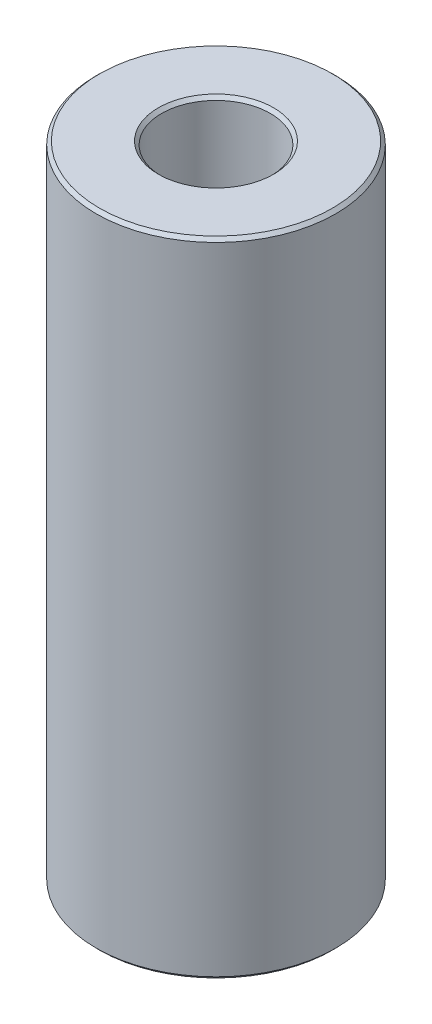
from build123d import *
from OCP.BRepFilletAPI import BRepFilletAPI_MakeChamfer

# Parameters (mm, degrees)
SKETCH1_R           = 55
BOSS_EXTRUDE1_DEPTH = 295.099877021
SKETCH2_R           = 24.989155254
CUT_EXTRUDE1_DEPTH  = 306.178533678
CHAMFER1_SIZE       = 1.483339645
CHAMFER1_SIZE2      = 1.515280432


with BuildPart() as part:
    # Sketch1 → Boss-Extrude1 (new body)
    with BuildSketch(Plane(origin=(0, 0, 0), x_dir=(1, 0, 0), z_dir=(0, 1, 0))):
        Circle(SKETCH1_R)
    extrude(amount=BOSS_EXTRUDE1_DEPTH)

    # Sketch2 → Cut-Extrude1 (cut, through all)
    with BuildSketch(Plane(origin=(0, 0, 0), x_dir=(1, 0, 0), z_dir=(0, 1, 0))):
        Circle(SKETCH2_R)
    extrude(amount=CUT_EXTRUDE1_DEPTH, mode=Mode.SUBTRACT)

    # Chamfer1: one chamfer whose edges measure the first distance from different faces: ONE call of the kernel's chamfer builder (chamfer() names one face for all edges)
    chamfer1_edges_1 = [part.edges().sort_by_distance(p)[0] for p in [
        (-24.989155254, 295.099877021, 0),
    ]]
    chamfer1_side_1 = [part.faces().sort_by_distance(p)[0] for p in [
        (-53.444365081, 295.099877021, 0),
    ]]
    chamfer1_edges_2 = [part.edges().sort_by_distance(p)[0] for p in [
        (-24.989155254, 0, 0),
    ]]
    chamfer1_side_2 = [part.faces().sort_by_distance(p)[0] for p in [
        (-24.989155254, 147.549938511, 0),
    ]]
    chamfer1_edges_3 = [part.edges().sort_by_distance(p)[0] for p in [
        (-55, 0, 0),
    ]]
    chamfer1_side_3 = [part.faces().sort_by_distance(p)[0] for p in [
        (-53.444365081, 0, 0),
    ]]
    chamfer1_edges_4 = [part.edges().sort_by_distance(p)[0] for p in [
        (-55, 295.099877021, 0),
    ]]
    chamfer1_side_4 = [part.faces().sort_by_distance(p)[0] for p in [
        (-55, 147.549938511, 0),
    ]]
    chamfer1 = BRepFilletAPI_MakeChamfer(part.part.solid().wrapped)
    for e in chamfer1_edges_1:
        chamfer1.Add(CHAMFER1_SIZE, CHAMFER1_SIZE2, e.wrapped, chamfer1_side_1[0].wrapped)  # the first distance lies on this face
    for e in chamfer1_edges_2:
        chamfer1.Add(CHAMFER1_SIZE, CHAMFER1_SIZE2, e.wrapped, chamfer1_side_2[0].wrapped)  # the first distance lies on this face
    for e in chamfer1_edges_3:
        chamfer1.Add(CHAMFER1_SIZE, CHAMFER1_SIZE2, e.wrapped, chamfer1_side_3[0].wrapped)  # the first distance lies on this face
    for e in chamfer1_edges_4:
        chamfer1.Add(CHAMFER1_SIZE, CHAMFER1_SIZE2, e.wrapped, chamfer1_side_4[0].wrapped)  # the first distance lies on this face
    add(Compound.cast(chamfer1.Shape()), mode=Mode.REPLACE)


solid = part.part
